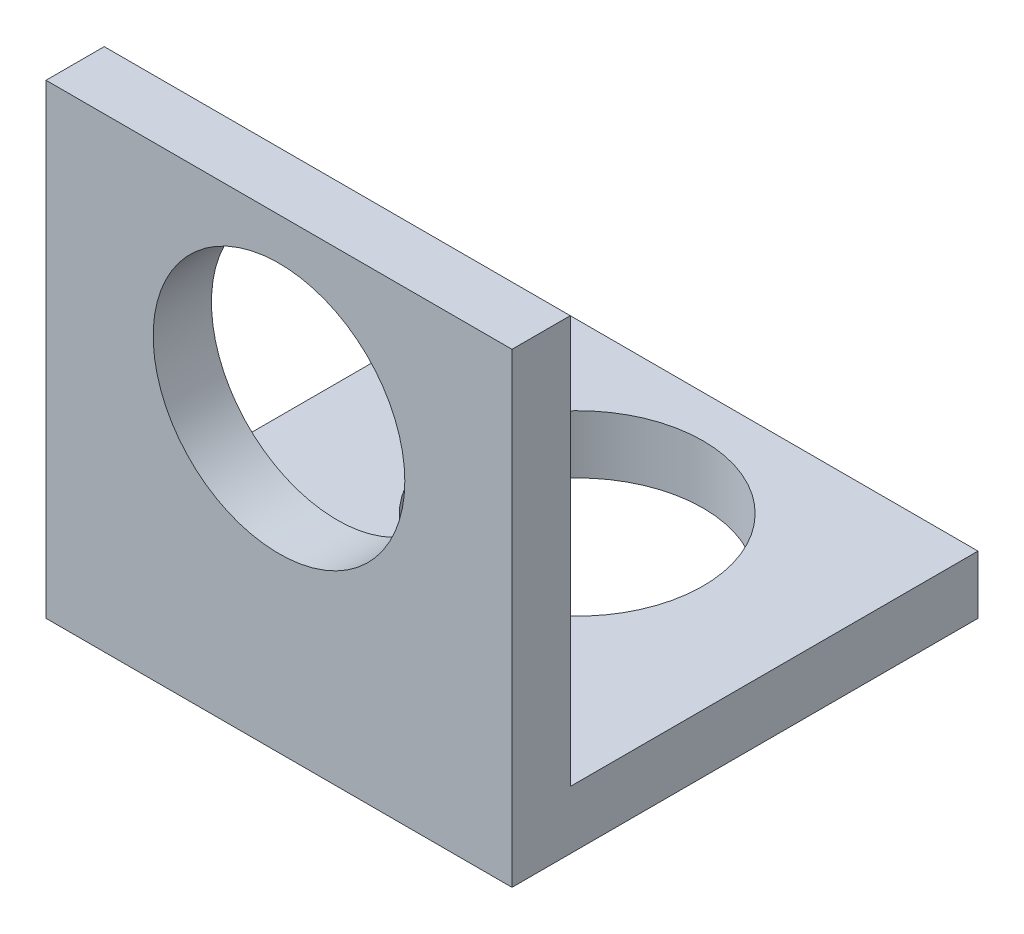
from build123d import *

# Parameters (mm, degrees)
BOSS_EXTRUDE1_DEPTH = 12.7
SKETCH2_R           = 3.429
CUT_EXTRUDE1_DEPTH  = 22.997045256
SKETCH3_R           = 3.429
CUT_EXTRUDE2_DEPTH  = 22.997045256


with BuildPart() as part:
    # Sketch1 → Boss-Extrude1 (new body)
    with BuildSketch(Plane(origin=(0, 0, 0), x_dir=(0, 0, -1), z_dir=(1, 0, 0))):
        Polygon((0, 0), (0, 12.7), (1.5875, 12.7), (1.5875, 1.5875), (12.7, 1.5875), (12.7, 0), align=None)
    extrude(amount=BOSS_EXTRUDE1_DEPTH)

    # Sketch2 → Cut-Extrude1 (cut, through all)
    with BuildSketch(Plane.XY):
        with Locations((6.35, 8.128)):
            Circle(SKETCH2_R)
    extrude(amount=-CUT_EXTRUDE1_DEPTH, mode=Mode.SUBTRACT)

    # Sketch3 → Cut-Extrude2 (cut, through all)
    with BuildSketch(Plane.XZ):
        with Locations((6.35, -8.128)):
            Circle(SKETCH3_R)
    extrude(amount=-CUT_EXTRUDE2_DEPTH, mode=Mode.SUBTRACT)


solid = part.part
